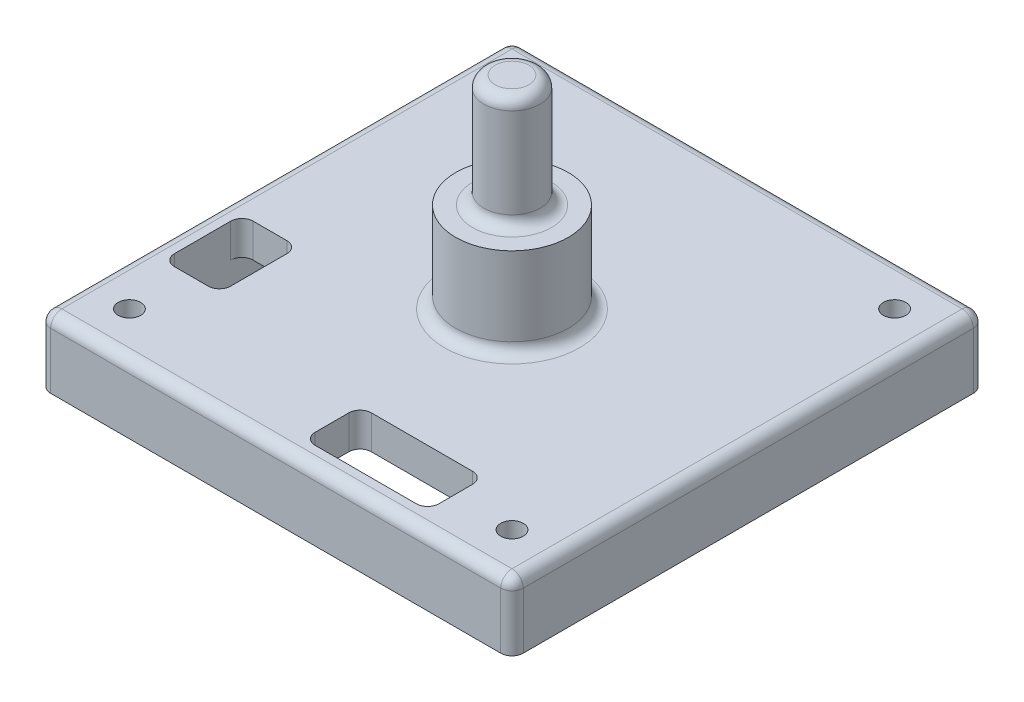
from build123d import *

# Parameters (mm, degrees)
SKETCH1_W           = 42
SKETCH1_H           = 42
BOSS_EXTRUDE1_DEPTH = 6
SKETCH2_W           = 38.5
SKETCH2_H           = 38.5
CUT_EXTRUDE1_DEPTH  = 3
CUT_EXTRUDE2_REACH  = 31.85
SKETCH3_W           = 5
SKETCH3_H           = 7
SKETCH3_W_2         = 11
SKETCH3_H_2         = 5
BOSS_EXTRUDE2_DEPTH = 1.5
SKETCH5_R           = 1
CUT_EXTRUDE3_DEPTH  = 31.037476592
SKETCH6_R           = 5
BOSS_EXTRUDE3_DEPTH = 8
SKETCH7_R           = 2.5
BOSS_EXTRUDE4_DEPTH = 10
FILLET1_R           = 1


with BuildPart() as part:
    # Sketch1 → Boss-Extrude1 (new body)
    with BuildSketch(Plane(origin=(0, 0, 0), x_dir=(1, 0, 0), z_dir=(0, 1, 0))):
        Rectangle(SKETCH1_W, SKETCH1_H)
    extrude(amount=BOSS_EXTRUDE1_DEPTH)

    # Sketch2 → Cut-Extrude1 (cut)
    with BuildSketch(Plane.XZ):
        Rectangle(SKETCH2_W, SKETCH2_H)
    extrude(amount=-CUT_EXTRUDE1_DEPTH, mode=Mode.SUBTRACT)

    # Sketch3 → Cut-Extrude2 (cut, up to next)
    with BuildSketch(Plane.XZ.offset(-3), mode=Mode.PRIVATE) as cut_extrude2_sk1:
        with Locations((-16.75, 8.25)):
            Rectangle(SKETCH3_W, SKETCH3_H)
    cut_extrude2_tool1 = extrude(cut_extrude2_sk1.sketch, amount=-CUT_EXTRUDE2_REACH, mode=Mode.PRIVATE) & part.part
    # Sketch3 → Cut-Extrude2 (cut, up to next)
    with BuildSketch(Plane.XZ.offset(-3), mode=Mode.PRIVATE) as cut_extrude2_sk2:
        with Locations((6.25, 16.75)):
            Rectangle(SKETCH3_W_2, SKETCH3_H_2)
    cut_extrude2_tool2 = extrude(cut_extrude2_sk2.sketch, amount=-CUT_EXTRUDE2_REACH, mode=Mode.PRIVATE) & part.part
    add(cut_extrude2_tool1.solids().sort_by_distance((-16.75, 3, 8.25))[0], mode=Mode.SUBTRACT)
    add(cut_extrude2_tool2.solids().sort_by_distance((6.25, 3, 16.75))[0], mode=Mode.SUBTRACT)

    # Sketch4 → Boss-Extrude2 (add)
    with BuildSketch(Plane.XZ.offset(-3)):
        with BuildLine():
            Line((-19.25, 15.910275264), (-19.25, 19.25))
            Line((-19.25, 19.25), (-15.910275264, 19.25))
            ThreePointArc((-15.910275264, 19.25), (-15.232233047, 15.232233047), (-19.25, 15.910275264))
        make_face()
        with BuildLine():
            Line((19.25, 19.25), (15.910275264, 19.25))
            ThreePointArc((15.910275264, 19.25), (15.232233047, 15.232233047), (19.25, 15.910275264))
            Line((19.25, 15.910275264), (19.25, 19.25))
        make_face()
        with BuildLine():
            Line((-19.25, -19.25), (-15.910275264, -19.25))
            ThreePointArc((-15.910275264, -19.25), (-15.232233047, -15.232233047), (-19.25, -15.910275264))
            Line((-19.25, -15.910275264), (-19.25, -19.25))
        make_face()
        with BuildLine():
            Line((19.25, -15.910275264), (19.25, -19.25))
            Line((19.25, -19.25), (15.910275264, -19.25))
            ThreePointArc((15.910275264, -19.25), (15.232233047, -15.232233047), (19.25, -15.910275264))
        make_face()
    extrude(amount=BOSS_EXTRUDE2_DEPTH)

    # Sketch5 → Cut-Extrude3 (cut, through all)
    with BuildSketch(Plane.XZ.offset(-1.5)):
        with Locations((-17, 17)):
            Circle(SKETCH5_R)
        with Locations((17, 17)):
            Circle(SKETCH5_R)
        with Locations((17, -17)):
            Circle(SKETCH5_R)
        with Locations((-17, -17)):
            Circle(SKETCH5_R)
    extrude(amount=-CUT_EXTRUDE3_DEPTH, mode=Mode.SUBTRACT)

    # Sketch6 → Boss-Extrude3 (add)
    with BuildSketch(Plane(origin=(0, 6, 0), x_dir=(1, 0, 0), z_dir=(0, 1, 0))):
        Circle(SKETCH6_R)
    extrude(amount=BOSS_EXTRUDE3_DEPTH)

    # Sketch7 → Boss-Extrude4 (add)
    with BuildSketch(Plane(origin=(0, 14, 0), x_dir=(1, 0, 0), z_dir=(0, 1, 0))):
        Circle(SKETCH7_R)
    extrude(amount=BOSS_EXTRUDE4_DEPTH)

    # Fillet1
    fillet1_edges = [part.edges().sort_by_distance(p)[0] for p in [
        (-2.5, 24, 0),
        (0, 6, -21),
        (-21, 6, 0),
        (0, 6, 21),
        (21, 6, 0),
        (-21, 3, 21),
        (-21, 3, -21),
        (21, 3, -21),
        (21, 3, 21),
        (0.75, 4.5, 14.25),
        (0.75, 4.5, 19.25),
        (11.75, 4.5, 19.25),
        (11.75, 4.5, 14.25),
        (-19.25, 4.5, 4.75),
        (-19.25, 4.5, 11.75),
        (-14.25, 4.5, 11.75),
        (-14.25, 4.5, 4.75),
        (-2.5, 14, 0),
        (-5, 6, 0),
    ]]
    fillet(fillet1_edges, radius=FILLET1_R)


solid = part.part
